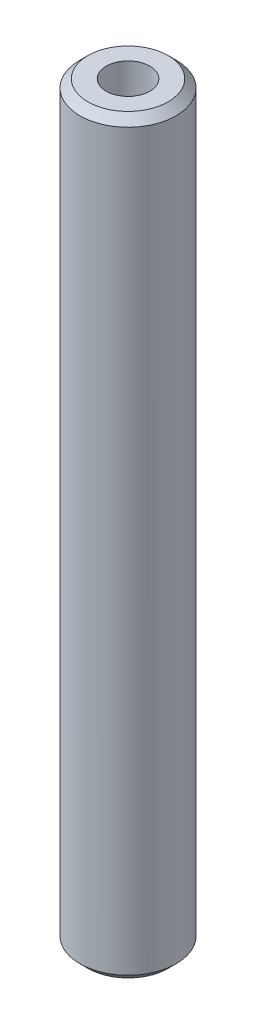
from build123d import *

# Parameters (mm, degrees)
SKETCH1_R           = 27.5
BOSS_EXTRUDE1_DEPTH = 428.601661326
SKETCH2_R           = 12.453379243
CUT_EXTRUDE1_DEPTH  = 431.36250312
CHAMFER1_SIZE       = 4.592654734


with BuildPart() as part:
    # Sketch1 → Boss-Extrude1 (new body)
    with BuildSketch(Plane(origin=(0, 0, 0), x_dir=(1, 0, 0), z_dir=(0, 1, 0))):
        Circle(SKETCH1_R)
    extrude(amount=BOSS_EXTRUDE1_DEPTH)

    # Sketch2 → Cut-Extrude1 (cut, through all)
    with BuildSketch(Plane(origin=(0, 0, 0), x_dir=(1, 0, 0), z_dir=(0, 1, 0))):
        Circle(SKETCH2_R)
    extrude(amount=CUT_EXTRUDE1_DEPTH, mode=Mode.SUBTRACT)

    # Chamfer1
    chamfer1_edges = [part.edges().sort_by_distance(p)[0] for p in [
        (-27.5, 428.601661326, 0),
        (-27.5, 0, 0),
    ]]
    chamfer(chamfer1_edges, length=CHAMFER1_SIZE)


solid = part.part
